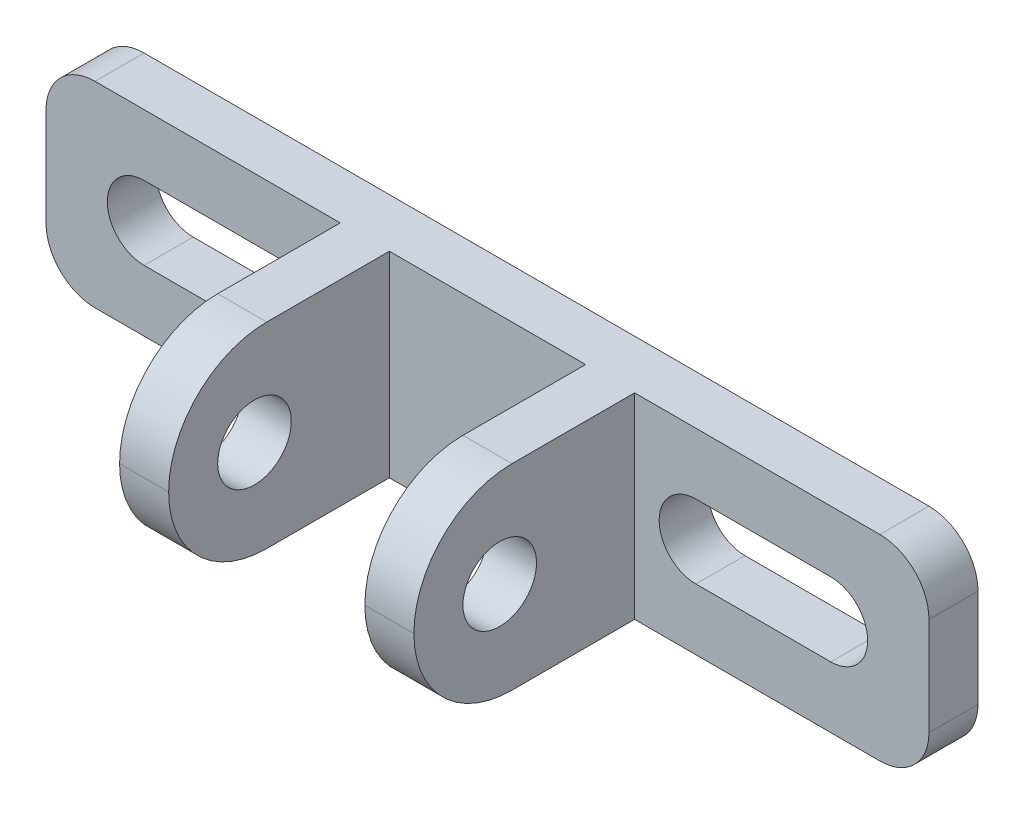
from build123d import *

# Parameters (mm, degrees)
SKETCH_1_W               = 36
SKETCH_1_H               = 8
EXTRUDE_1_DEPTH          = 11
SKETCH_2_W               = 8
SKETCH_2_H               = 8
SKETCH_2_W_2             = 12
CUT_EXTRUDE_1_DEPTH      = 9
FILLET_1_R               = 4
CUT_EXTRUDE_2_DEPTH      = 28.586228448
CUT_EXTRUDE_2_DEPTH_BACK = 28.586228448
SKETCH_3_R               = 1.5
FILLET_2_R               = 2
CUT_EXTRUDE_3_DEPTH      = 9


with BuildPart() as part:
    # 草图1 → 凸台-拉伸1 (new body)
    with BuildSketch(Plane.XY):
        with Locations((18, -4)):
            Rectangle(SKETCH_1_W, SKETCH_1_H)
    extrude(amount=EXTRUDE_1_DEPTH)

    # 草图2 → 切除-拉伸1 (cut)
    with BuildSketch(Plane.XY.offset(11)):
        with Locations((18, -4)):
            Rectangle(SKETCH_2_W, SKETCH_2_H)
        with Locations((6, -4)):
            Rectangle(SKETCH_2_W_2, SKETCH_2_H)
        with Locations((30, -4)):
            Rectangle(SKETCH_2_W_2, SKETCH_2_H)
    extrude(amount=-CUT_EXTRUDE_1_DEPTH, mode=Mode.SUBTRACT)

    # 圆角1
    fillet_1_edges = [part.edges().sort_by_distance(p)[0] for p in [
        (23, -8, 11),
        (23, 0, 11),
        (13, 0, 11),
        (13, -8, 11),
    ]]
    fillet(fillet_1_edges, radius=FILLET_1_R - 0.0001)  # a hair under: the kernel refuses the full size

    # 草图3 → 切除-拉伸2 (cut, two sides: drawn at the far end of the back side and taken through both)
    with BuildSketch(Plane.ZY.offset(-12).offset(-CUT_EXTRUDE_2_DEPTH_BACK)):
        with Locations((7.5, -4)):
            Circle(SKETCH_3_R)
    extrude(amount=CUT_EXTRUDE_2_DEPTH + CUT_EXTRUDE_2_DEPTH_BACK, mode=Mode.SUBTRACT)

    # 圆角2
    fillet_2_edges = [part.edges().sort_by_distance(p)[0] for p in [
        (0, -8, 1),
        (0, 0, 1),
        (36, 0, 1),
        (36, -8, 1),
    ]]
    fillet(fillet_2_edges, radius=FILLET_2_R)

    # 草图4 → 切除-拉伸3 (cut)
    with BuildSketch(Plane.XY.offset(2)):
        with BuildLine():
            Line((32, -2.5), (26.5, -2.5))
            ThreePointArc((26.5, -2.5), (25, -4), (26.5, -5.5))
            Line((26.5, -5.5), (32, -5.5))
            ThreePointArc((32, -5.5), (33.5, -4), (32, -2.5))
        make_face()
        with BuildLine():
            Line((4, -2.5), (9.5, -2.5))
            ThreePointArc((9.5, -2.5), (11, -4), (9.5, -5.5))
            Line((9.5, -5.5), (4, -5.5))
            ThreePointArc((4, -5.5), (2.5, -4), (4, -2.5))
        make_face()
    extrude(amount=-CUT_EXTRUDE_3_DEPTH, mode=Mode.SUBTRACT)


solid = part.part
